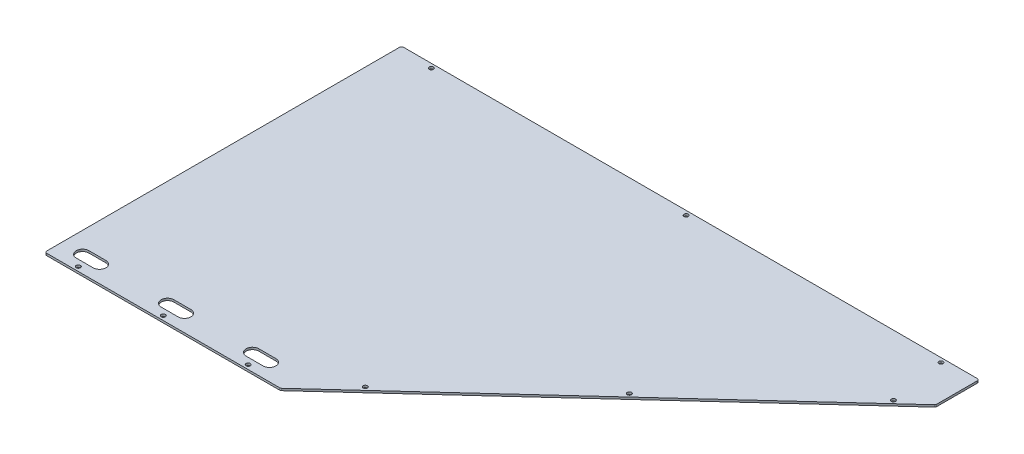
from build123d import *

# Parameters (mm, degrees)
BOSS_EXTRUDE1_DEPTH         = 3.175
FILLET1_R                   = 3.175
F_1_4_0_25_DIAMETER_HOLE1_D = 6.35
SKETCH5_R                   = 3.175
CUT_EXTRUDE1_DEPTH          = 1016.052018679


with BuildPart() as part:
    # Sketch1 → Boss-Extrude1 (new body)
    with BuildSketch(Plane(origin=(0, 0, 0), x_dir=(1, 0, 0), z_dir=(0, 1, 0))):
        Polygon((0, 0), (352.425, 0), (863.6, 468.405587878), (863.6, 533.4), (0, 533.4), align=None)
    extrude(amount=BOSS_EXTRUDE1_DEPTH)

    # Fillet1
    fillet1_edges = [part.edges().sort_by_distance(p)[0] for p in [
        (0, 1.5875, 0),
        (863.6, 1.5875, -533.4),
        (863.6, 1.5875, -468.405587878),
        (352.425, 1.5875, 0),
        (0, 1.5875, -533.4),
    ]]
    fillet(fillet1_edges, radius=FILLET1_R)

    # 1/4 (0.25) Diameter Hole1 (through all)
    with Locations(Plane(origin=(0, 3.175, 0), x_dir=(1, 0, 0), z_dir=(0, 1, 0))):
        with Locations((43.832655013, 6.35), (170.832655013, 6.35), (297.832655013, 6.35), (414.05335701, 65.084754558), (620.048644915, 253.844658566), (826.043932819, 442.604562573), (50.8, 527.05), (431.8, 527.05), (812.8, 527.05)):
            Hole(F_1_4_0_25_DIAMETER_HOLE1_D / 2)

    # Sketch5 → Cut-Extrude1 (cut, through all)
    with BuildSketch(Plane(origin=(0, 3.175, 0), x_dir=(1, 0, 0), z_dir=(0, 1, 0))):
        with Locations((297.832655013, 6.35)):
            Circle(SKETCH5_R)
        with Locations((170.832655013, 6.35)):
            Circle(SKETCH5_R)
        with Locations((43.832655013, 6.35)):
            Circle(SKETCH5_R)
        with BuildLine():
            Line((31.132655013, 34.925), (56.532655013, 34.925))
            ThreePointArc((56.532655013, 34.925), (66.057655013, 25.4), (56.532655013, 15.875))
            Line((56.532655013, 15.875), (31.132655013, 15.875))
            ThreePointArc((31.132655013, 15.875), (21.607655013, 25.4), (31.132655013, 34.925))
        make_face()
        with BuildLine():
            Line((158.132655013, 34.925), (183.532655013, 34.925))
            ThreePointArc((183.532655013, 34.925), (193.057655013, 25.4), (183.532655013, 15.875))
            Line((183.532655013, 15.875), (158.132655013, 15.875))
            ThreePointArc((158.132655013, 15.875), (148.607655013, 25.4), (158.132655013, 34.925))
        make_face()
        with BuildLine():
            Line((285.132655013, 34.925), (310.532655013, 34.925))
            ThreePointArc((310.532655013, 34.925), (320.057655013, 25.4), (310.532655013, 15.875))
            Line((310.532655013, 15.875), (285.132655013, 15.875))
            ThreePointArc((285.132655013, 15.875), (275.607655013, 25.4), (285.132655013, 34.925))
        make_face()
    extrude(amount=-CUT_EXTRUDE1_DEPTH, mode=Mode.SUBTRACT)


solid = part.part
